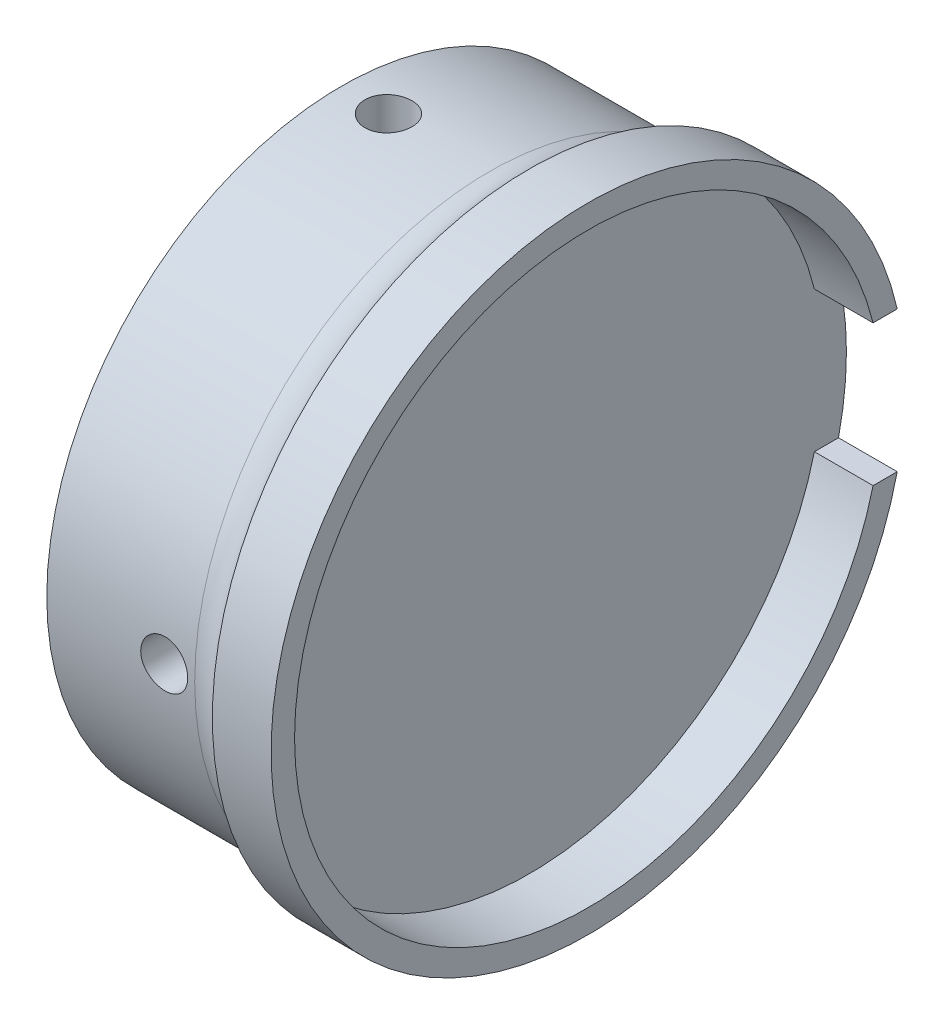
from build123d import *

# Parameters (mm, degrees)
SKETCH_1_R                      = 12.55
EXTRUDE_1_DEPTH                 = 8
SKETCH_2_R                      = 3
CUT_EXTRUDE_1_DEPTH             = 7
CUT_EXTRUDE_2_REACH             = 21.468
SKETCH_3_R                      = 1
CUT_EXTRUDE_2_DIRECTION_2_REACH = 21.468
CUT_EXTRUDE_3_DEPTH             = 21
CUT_EXTRUDE_3_DEPTH_BACK        = 19
SKETCH_4_R                      = 1
SKETCH_5_R                      = 13.5
EXTRUDE_2_DEPTH                 = 2.5
SKETCH_6_R                      = 12.5
CUT_EXTRUDE_4_DEPTH             = 2.5
FILLET_1_R                      = 2
SKETCH_7_W                      = 2.5
SKETCH_7_H                      = 6
CUT_EXTRUDE_5_DEPTH             = 21.5


with BuildPart() as part:
    # 草图1 → 凸台-拉伸1 (new body)
    with BuildSketch(Plane(origin=(0, 0, 0), x_dir=(0, 0, -1), z_dir=(1, 0, 0))):
        Circle(SKETCH_1_R)
    extrude(amount=EXTRUDE_1_DEPTH)

    # 草图2 → 切除-拉伸1 (cut)
    with BuildSketch(Plane.ZY):
        Circle(SKETCH_2_R)
    extrude(amount=-CUT_EXTRUDE_1_DEPTH, mode=Mode.SUBTRACT)

    # 草图3 → 切除-拉伸2 (cut, up to next)
    with BuildSketch(Plane(origin=(0, 0, 0), x_dir=(1, 0, 0), z_dir=(0, 1, 0)), mode=Mode.PRIVATE) as cut_extrude_2_sk1:
        with Locations(Location((2, 0, 0), (0, 0, 270))):
            Circle(SKETCH_3_R)
    cut_extrude_2_tool1 = extrude(cut_extrude_2_sk1.sketch, amount=-CUT_EXTRUDE_2_REACH, mode=Mode.PRIVATE) & part.part
    add(cut_extrude_2_tool1.solids().sort_by_distance((2, 0, 0))[0], mode=Mode.SUBTRACT)

    # 草图3 → 切除-拉伸2 direction 2 (cut, up to next)
    with BuildSketch(Plane(origin=(0, 0, 0), x_dir=(1, 0, 0), z_dir=(0, 1, 0)), mode=Mode.PRIVATE) as cut_extrude_2_direction_2_sk1:
        with Locations(Location((2, 0, 0), (0, 0, 270))):
            Circle(SKETCH_3_R)
    cut_extrude_2_direction_2_tool1 = extrude(cut_extrude_2_direction_2_sk1.sketch, amount=CUT_EXTRUDE_2_DIRECTION_2_REACH, mode=Mode.PRIVATE) & part.part
    add(cut_extrude_2_direction_2_tool1.solids().sort_by_distance((2, 0, 0))[0], mode=Mode.SUBTRACT)

    # 草图4 → 切除-拉伸3 (cut, two sides: drawn at the far end of the back side and taken through both)
    with BuildSketch(Plane.XY.offset(-CUT_EXTRUDE_3_DEPTH_BACK)):
        with Locations(Location((5, 0, 0), (0, 0, 180))):
            Circle(SKETCH_4_R)
    extrude(amount=CUT_EXTRUDE_3_DEPTH + CUT_EXTRUDE_3_DEPTH_BACK, mode=Mode.SUBTRACT)

    # 草图5 → 凸台-拉伸2 (add)
    with BuildSketch(Plane(origin=(8, 0, 0), x_dir=(0, 0, -1), z_dir=(1, 0, 0))):
        Circle(SKETCH_5_R)
    extrude(amount=EXTRUDE_2_DEPTH)

    # 草图6 → 切除-拉伸4 (cut)
    with BuildSketch(Plane(origin=(10.5, 0, 0), x_dir=(0, 0, -1), z_dir=(1, 0, 0))):
        Circle(SKETCH_6_R)
    extrude(amount=-CUT_EXTRUDE_4_DEPTH, mode=Mode.SUBTRACT)

    # 圆角1
    # the kernel refuses this fillet: 2 mm, written as the material it adds along each edge
    with BuildSketch(Plane(origin=(8, 0, 0), x_dir=(0, 0, -1), z_dir=(0, -1, 0))) as fillet_1_piece_1:
        with BuildLine():
            CenterArc((14.55, -1.702204453), FILLET_1_R, 121.668243254, 58.331756746)
            Line((12.55, -1.702204453), (12.51, -1.702204453))
            Line((12.51, -1.702204453), (12.51, 0))
            Line((12.51, 0), (12.55, 0.04))
            ThreePointArc((12.55, 0.04), (13.025, 0.04), (13.479, 0.034044089))
            Line((13.479, 0.034044089), (13.5, 0))
        make_face()
    revolve(axis=Axis((8, 0, 0), (1, 0, 0)))

    # 草图7 → 切除-拉伸5 (cut)
    with BuildSketch(Plane.XY):
        with Locations((9.25, 0)):
            Rectangle(SKETCH_7_W, SKETCH_7_H)
    extrude(amount=-CUT_EXTRUDE_5_DEPTH, mode=Mode.SUBTRACT)


solid = part.part
